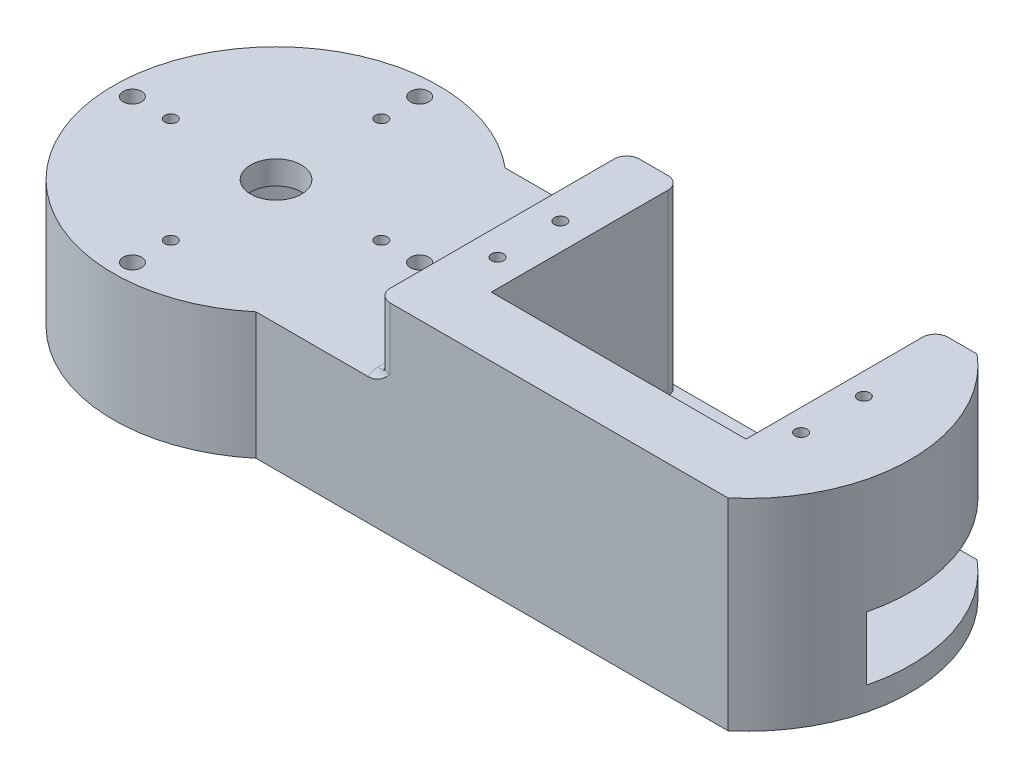
from build123d import *

# Parameters (mm, degrees)
SKETCH1_R                = 25.65
SKETCH1_R_2              = 19.65
SKETCH1_R_3              = 4
SKETCH1_R_4              = 0.95
SKETCH1_W                = 40.16
SKETCH1_H                = 20.39
BOSS_EXTRUDE2_DEPTH      = 3.7
SKETCH5_R                = 19.65
SKETCH5_W                = 40.16
SKETCH5_H                = 20.39
BOSS_EXTRUDE3_DEPTH      = 28.1
CUT_EXTRUDE1_REACH       = 112.955
SKETCH6_W                = 40.16
SKETCH6_H                = 28.1
CUT_EXTRUDE2_REACH       = 119.305
CUT_EXTRUDE2_END_RADIUS  = 25.65
SKETCH7_W                = 29.863740461
SKETCH7_H                = 10
CUT_EXTRUDE3_DEPTH       = 109.093330622
CUT_EXTRUDE3_DEPTH_BACK  = 109.093330622
SKETCH8_R                = 1.45
SKETCH9_R                = 0.95
CUT_EXTRUDE4_DEPTH       = 12
CUT_EXTRUDE5_DEPTH       = 109.093330622
FILLET1_R                = 2
CUT_EXTRUDE6_DEPTH       = 11.8
BOSS_EXTRUDE4_START      = -3.7
SKETCH14_R               = 19.65
SKETCH14_R_2             = 0.95
SKETCH14_R_3             = 4
BOSS_EXTRUDE4_DEPTH      = 3.7
CUT_EXTRUDE7_START       = -3.7
CUT_EXTRUDE7_OUTLINE_R   = 19.65
CUT_EXTRUDE7_OUTLINE_R_2 = 0.95
CUT_EXTRUDE7_OUTLINE_R_3 = 4
CUT_EXTRUDE7_DEPTH       = 3.7
FILLET2_R                = 2
FILLET3_R                = 2


# Read off the part's stored shape, not the designer's step: Cut-Extrude7
with BuildPart() as part:
    # Sketch1 → Boss-Extrude2 (new body)
    # profile 1 of 6: a face of its own
    with BuildSketch(Plane(origin=(0, 0, 0), x_dir=(1, 0, 0), z_dir=(0, 1, 0))):
        Circle(SKETCH1_R)
        Circle(SKETCH1_R_2, mode=Mode.SUBTRACT)
    # profile 2 of 6: a face of its own
    with BuildSketch(Plane(origin=(0, 0, 0), x_dir=(1, 0, 0), z_dir=(0, 1, 0))):
        Circle(SKETCH1_R_2)
        with Locations(Location((0, 0, 0), (0, 0, 270))):
            Circle(SKETCH1_R_3, mode=Mode.SUBTRACT)
        with Locations(Location((16.6, 0, 0), (0, 0, 270))):
            Circle(SKETCH1_R_4, mode=Mode.SUBTRACT)
        with Locations(Location((0, -16.6, 0), (0, 0, 270))):
            Circle(SKETCH1_R_4, mode=Mode.SUBTRACT)
        with Locations(Location((-16.6, 0, 0), (0, 0, 270))):
            Circle(SKETCH1_R_4, mode=Mode.SUBTRACT)
        with Locations(Location((0, 16.6, 0), (0, 0, 270))):
            Circle(SKETCH1_R_4, mode=Mode.SUBTRACT)
    # profile 3 of 6: a face of its own
    with BuildSketch(Plane(origin=(0, 0, 0), x_dir=(1, 0, 0), z_dir=(0, 1, 0))):
        with BuildLine():
            Line((35.65, 18.695), (91.986875612, 18.695))
            ThreePointArc((91.986875612, 18.695), (83.869462663, 23.847948025), (74.425, 25.65))
            Line((74.425, 25.65), (0, 25.65))
            ThreePointArc((0, 25.65), (18.137288937, 18.137288937), (25.65, 0))
            ThreePointArc((25.65, 0), (18.137288937, -18.137288937), (0, -25.65))
            Line((0, -25.65), (74.425, -25.65))
            ThreePointArc((74.425, -25.65), (83.869462663, -23.847948025), (91.986875612, -18.695))
            Line((91.986875612, -18.695), (35.65, -18.695))
            Line((35.65, -18.695), (35.65, 18.695))
        make_face()
    # profile 4 of 6: a face of its own
    with BuildSketch(Plane(origin=(0, 0, 0), x_dir=(1, 0, 0), z_dir=(0, 1, 0))):
        with BuildLine():
            Line((92.81, -17.886147573), (92.81, 17.886147573))
            ThreePointArc((92.81, 17.886147573), (92.402987293, 18.295203548), (91.986875612, 18.695))
            Line((91.986875612, 18.695), (35.65, 18.695))
            Line((35.65, 18.695), (35.65, -18.695))
            Line((35.65, -18.695), (91.986875612, -18.695))
            ThreePointArc((91.986875612, -18.695), (92.402987293, -18.295203548), (92.81, -17.886147573))
        make_face()
        with Locations((64.23, 0)):
            Rectangle(SKETCH1_W, SKETCH1_H, mode=Mode.SUBTRACT)
    # profile 5 of 6: a face of its own
    with BuildSketch(Plane(origin=(0, 0, 0), x_dir=(1, 0, 0), z_dir=(0, 1, 0))):
        with Locations((64.23, 0)):
            Rectangle(SKETCH1_W, SKETCH1_H)
    # profile 6 of 6: a face of its own
    with BuildSketch(Plane(origin=(0, 0, 0), x_dir=(1, 0, 0), z_dir=(0, 1, 0))):
        with BuildLine():
            ThreePointArc((92.81, -17.886147573), (100.075, 0), (92.81, 17.886147573))
            Line((92.81, 17.886147573), (92.81, -17.886147573))
        make_face()
    extrude(amount=BOSS_EXTRUDE2_DEPTH)

    # Sketch5 → Boss-Extrude3 (add)
    # profile 1 of 4: a face of its own
    with BuildSketch(Plane(origin=(0, 3.7, 0), x_dir=(1, 0, 0), z_dir=(0, 1, 0))):
        with BuildLine():
            ThreePointArc((25.65, 0), (18.137288937, 18.137288937), (0, 25.65))
            ThreePointArc((0, 25.65), (-25.65, 0), (0, -25.65))
            ThreePointArc((0, -25.65), (18.137288937, -18.137288937), (25.65, 0))
        make_face()
        with Locations(Location((0, 0, 0), (0, 0, 270))):
            Circle(SKETCH5_R, mode=Mode.SUBTRACT)
    # profile 2 of 4: a face of its own
    with BuildSketch(Plane(origin=(0, 3.7, 0), x_dir=(1, 0, 0), z_dir=(0, 1, 0))):
        with BuildLine():
            ThreePointArc((92.81, 17.886147573), (92.402987293, 18.295203548), (91.986875612, 18.695))
            Line((91.986875612, 18.695), (35.65, 18.695))
            Line((35.65, 18.695), (35.65, -18.695))
            Line((35.65, -18.695), (91.986875612, -18.695))
            ThreePointArc((91.986875612, -18.695), (92.402987293, -18.295203548), (92.81, -17.886147573))
            Line((92.81, -17.886147573), (92.81, 17.886147573))
        make_face()
        with Locations((64.23, 0)):
            Rectangle(SKETCH5_W, SKETCH5_H, mode=Mode.SUBTRACT)
    # profile 3 of 4: a face of its own
    with BuildSketch(Plane(origin=(0, 3.7, 0), x_dir=(1, 0, 0), z_dir=(0, 1, 0))):
        with BuildLine():
            ThreePointArc((91.986875612, 18.695), (83.869462663, 23.847948025), (74.425, 25.65))
            Line((74.425, 25.65), (0, 25.65))
            ThreePointArc((0, 25.65), (18.137288937, 18.137288937), (25.65, 0))
            ThreePointArc((25.65, 0), (18.137288937, -18.137288937), (0, -25.65))
            Line((0, -25.65), (74.425, -25.65))
            ThreePointArc((74.425, -25.65), (83.869462663, -23.847948025), (91.986875612, -18.695))
            Line((91.986875612, -18.695), (35.65, -18.695))
            Line((35.65, -18.695), (35.65, 18.695))
            Line((35.65, 18.695), (91.986875612, 18.695))
        make_face()
    # profile 4 of 4: a face of its own
    with BuildSketch(Plane(origin=(0, 3.7, 0), x_dir=(1, 0, 0), z_dir=(0, 1, 0))):
        with BuildLine():
            ThreePointArc((92.81, -17.886147573), (100.075, 0), (92.81, 17.886147573))
            Line((92.81, 17.886147573), (92.81, -17.886147573))
        make_face()
    extrude(amount=BOSS_EXTRUDE3_DEPTH)

    # Sketch6 → Cut-Extrude1 (cut, up to next)
    with BuildSketch(Plane.XY.offset(-10.195), mode=Mode.PRIVATE) as cut_extrude1_sk1:
        with Locations((64.23, 17.75)):
            Rectangle(SKETCH6_W, SKETCH6_H)
    cut_extrude1_tool1 = extrude(cut_extrude1_sk1.sketch, amount=-CUT_EXTRUDE1_REACH, mode=Mode.PRIVATE) & part.part
    add(cut_extrude1_tool1.solids().sort_by_distance((64.23, 17.75, -10.195))[0], mode=Mode.SUBTRACT)

    # Cut-Extrude2: up to this cylinder (the profile starts inside it)
    cut_extrude2_end = Plane(origin=(74.425, 8.7, 0), z_dir=(0, -1, 0)) * Cylinder(CUT_EXTRUDE2_END_RADIUS, 290.91, mode=Mode.PRIVATE)
    # Sketch7 → Cut-Extrude2 (cut, up to the surface)
    with BuildSketch(Plane.ZY.offset(-84.31), mode=Mode.PRIVATE) as cut_extrude2_sk1:
        with Locations((-8.736870231, 8.7)):
            Rectangle(SKETCH7_W, SKETCH7_H)
    cut_extrude2_tool1 = extrude(cut_extrude2_sk1.sketch, amount=-CUT_EXTRUDE2_REACH, mode=Mode.PRIVATE) & cut_extrude2_end
    add(cut_extrude2_tool1.solids().sort_by_distance((84.31, 8.7, -8.73687))[0], mode=Mode.SUBTRACT)

    # Sketch8 → Cut-Extrude3 (cut, two sides: drawn at the far end of the back side and taken through both)
    with BuildSketch(Plane(origin=(0, 31.8, 0), x_dir=(1, 0, 0), z_dir=(0, 1, 0)).offset(-CUT_EXTRUDE3_DEPTH_BACK)):
        with Locations(Location((22.65, 0, 0), (0, 0, 270))):
            Circle(SKETCH8_R)
        with Locations(Location((0, -22.65, 0), (0, 0, 270))):
            Circle(SKETCH8_R)
        with Locations(Location((-22.65, 0, 0), (0, 0, 270))):
            Circle(SKETCH8_R)
        with Locations(Location((0, 22.65, 0), (0, 0, 270))):
            Circle(SKETCH8_R)
    extrude(amount=CUT_EXTRUDE3_DEPTH + CUT_EXTRUDE3_DEPTH_BACK, mode=Mode.SUBTRACT)

    # Sketch9 → Cut-Extrude4 (cut)
    with BuildSketch(Plane(origin=(0, 31.8, 0), x_dir=(1, 0, 0), z_dir=(0, 1, 0))):
        with Locations(Location((39.88, -4.95, 0), (0, 0, 270))):
            Circle(SKETCH9_R)
        with Locations(Location((39.88, 4.95, 0), (0, 0, 90))):
            Circle(SKETCH9_R)
        with Locations(Location((87.756875612, -4.95, 0), (0, 0, 90))):
            Circle(SKETCH9_R)
        with Locations(Location((87.756875612, 4.95, 0), (0, 0, 270))):
            Circle(SKETCH9_R)
    extrude(amount=-CUT_EXTRUDE4_DEPTH, mode=Mode.SUBTRACT)

    # Sketch12 → Cut-Extrude5 (cut, through all)
    with BuildSketch(Plane(origin=(0, 31.8, 0), x_dir=(1, 0, 0), z_dir=(0, 1, 0))):
        with BuildLine():
            Line((0, 25.65), (74.425, 25.65))
            ThreePointArc((74.425, 25.65), (83.19711491, 24.103371134), (90.911357997, 19.65))
            Line((90.911357997, 19.65), (16.486357997, 19.65))
            ThreePointArc((16.486357997, 19.65), (8.77211491, 24.103371134), (0, 25.65))
        make_face()
        with BuildLine():
            Line((0, -25.65), (74.425, -25.65))
            ThreePointArc((74.425, -25.65), (83.19711491, -24.103371134), (90.911357997, -19.65))
            Line((90.911357997, -19.65), (16.486357997, -19.65))
            ThreePointArc((16.486357997, -19.65), (8.77211491, -24.103371134), (0, -25.65))
        make_face()
    extrude(amount=-CUT_EXTRUDE5_DEPTH, mode=Mode.SUBTRACT)

    # Fillet1
    fillet1_edges = [part.edges().sort_by_distance(p)[0] for p in [
        (44.15, 17.75, -19.65),
        (84.31, 22.75, -19.65),
    ]]
    fillet(fillet1_edges, radius=FILLET1_R)

    # Sketch13 → Cut-Extrude6 (cut)
    with BuildSketch(Plane(origin=(0, 31.8, 0), x_dir=(1, 0, 0), z_dir=(0, 1, 0))):
        with BuildLine():
            Line((35.65, 19.65), (35.65, -19.65))
            Line((35.65, -19.65), (16.486357997, -19.65))
            ThreePointArc((16.486357997, -19.65), (-25.65, 0), (16.486357997, 19.65))
            Line((16.486357997, 19.65), (35.65, 19.65))
        make_face()
    extrude(amount=-CUT_EXTRUDE6_DEPTH, mode=Mode.SUBTRACT)

    # Sketch14 → Boss-Extrude4 (add)
    with BuildSketch(Plane(origin=(0, 20, 0), x_dir=(1, 0, 0), z_dir=(0, 1, 0)).offset(BOSS_EXTRUDE4_START)):
        with Locations(Location((0, 0, 0), (0, 0, 270))):
            Circle(SKETCH14_R)
        with Locations(Location((16.6, 0, 0), (0, 0, 270))):
            Circle(SKETCH14_R_2, mode=Mode.SUBTRACT)
        with Locations(Location((0, -16.6, 0), (0, 0, 270))):
            Circle(SKETCH14_R_2, mode=Mode.SUBTRACT)
        with Locations(Location((-16.6, 0, 0), (0, 0, 270))):
            Circle(SKETCH14_R_2, mode=Mode.SUBTRACT)
        with Locations(Location((0, 16.6, 0), (0, 0, 270))):
            Circle(SKETCH14_R_2, mode=Mode.SUBTRACT)
        with Locations(Location((0, 0, 0), (0, 0, 270))):
            Circle(SKETCH14_R_3, mode=Mode.SUBTRACT)
    extrude(amount=BOSS_EXTRUDE4_DEPTH)

    # Cut-Extrude7 outline → Cut-Extrude7 (cut)
    with BuildSketch(Plane.XZ.offset(CUT_EXTRUDE7_START)):
        Circle(CUT_EXTRUDE7_OUTLINE_R)
        with Locations((0, -16.6)):
            Circle(CUT_EXTRUDE7_OUTLINE_R_2, mode=Mode.SUBTRACT)
        with Locations((-16.6, 0)):
            Circle(CUT_EXTRUDE7_OUTLINE_R_2, mode=Mode.SUBTRACT)
        Circle(CUT_EXTRUDE7_OUTLINE_R_3, mode=Mode.SUBTRACT)
        with Locations((16.6, 0)):
            Circle(CUT_EXTRUDE7_OUTLINE_R_2, mode=Mode.SUBTRACT)
        with Locations((0, 16.6)):
            Circle(CUT_EXTRUDE7_OUTLINE_R_2, mode=Mode.SUBTRACT)
    extrude(amount=CUT_EXTRUDE7_DEPTH, mode=Mode.SUBTRACT)

    # Fillet2
    fillet2_edges = [part.edges().sort_by_distance(p)[0] for p in [
        (35.65, 25.9, -19.65),
        (35.65, 25.9, 19.65),
    ]]
    fillet(fillet2_edges, radius=FILLET2_R)

    # Fillet3
    fillet3_edges = [part.edges().sort_by_distance(p)[0] for p in [
        (35.65, 20, 0),
        (36.235786438, 20, -19.064213562),
        (36.235786438, 20, 19.064213562),
    ]]
    fillet(fillet3_edges, radius=FILLET3_R)


solid = part.part
